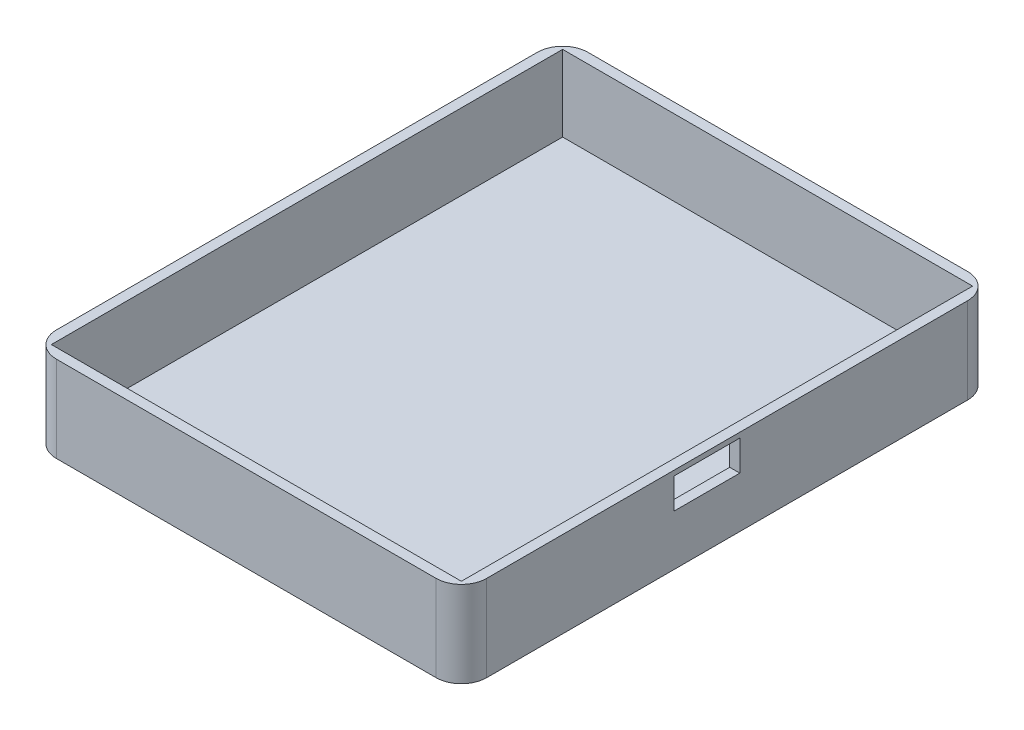
from build123d import *

# Parameters (mm, degrees)
SKETCH1_W           = 85
SKETCH1_H           = 105
BOSS_EXTRUDE1_DEPTH = 17
SHELL1_T            = -2
SKETCH3_W           = 13
SKETCH3_H           = 6
CUT_EXTRUDE1_DEPTH  = 10
FILLET1_R           = 5


with BuildPart() as part:
    # Sketch1 → Boss-Extrude1 (new body)
    with BuildSketch(Plane(origin=(0, 0, 0), x_dir=(1, 0, 0), z_dir=(0, 1, 0))):
        Rectangle(SKETCH1_W, SKETCH1_H)
    extrude(amount=BOSS_EXTRUDE1_DEPTH)

    # Shell1
    shell1_openings = [part.faces().sort_by_distance(p)[0] for p in [
        (0, 17, 0),
    ]]
    offset(amount=SHELL1_T, openings=shell1_openings, kind=Kind.INTERSECTION)

    # Sketch3 → Cut-Extrude1 (cut)
    with BuildSketch(Plane(origin=(42.5, 0, 0), x_dir=(0, 0, -1), z_dir=(1, 0, 0))):
        with Locations((-4, 13)):
            Rectangle(SKETCH3_W, SKETCH3_H)
    extrude(amount=-CUT_EXTRUDE1_DEPTH, mode=Mode.SUBTRACT)

    # Fillet1
    fillet1_edges = [part.edges().sort_by_distance(p)[0] for p in [
        (-42.5, 8.5, -52.5),
        (42.5, 8.5, -52.5),
        (42.5, 8.5, 52.5),
        (-42.5, 8.5, 52.5),
    ]]
    fillet(fillet1_edges, radius=FILLET1_R)


solid = part.part
